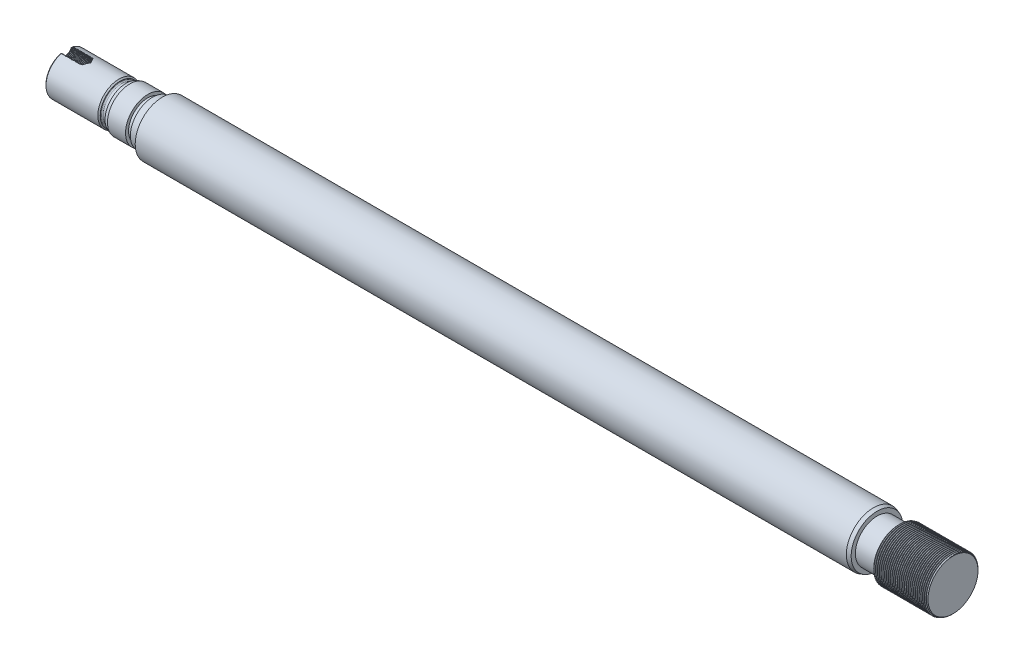
from build123d import *

# Parameters (mm, degrees)
M10_CLEARANCE_HOLE1_D     = 9
M10_CLEARANCE_HOLE1_DEPTH = 18
M10_CLEARANCE_HOLE1_TIP   = 2.7038727856240214
THREAD1_PITCH             = 1
THREAD2_PITCH             = 1.5000000000000002


with BuildPart() as part:
    # Sketch1 → Revolve1 (revolve)
    with BuildSketch(Plane(origin=(0, 0, 0), x_dir=(1, 0, 0), z_dir=(0, 1, 0)), mode=Mode.PRIVATE) as revolve1_sk:
        with BuildLine():
            Line((0, 0), (736, 0))
            Line((736, 0), (736, 20.749999999999996))
            Line((736, 20.749999999999996), (735, 21.75))
            Line((735, 21.75), (692, 21.75))
            Line((692, 21.75), (691, 20.749999999999996))
            Line((691, 20.749999999999996), (691, 18))
            Line((691, 18), (672.9999999999999, 18))
            Line((672.9999999999999, 18), (672.9999999999999, 21.5))
            Line((672.9999999999999, 21.5), (669.9999999999999, 22.5))
            Line((669.9999999999999, 22.5), (79.99999999999999, 22.5))
            Line((79.99999999999999, 22.5), (79.99999999999999, 18.5))
            Line((79.99999999999999, 18.5), (72, 18.5))
            Line((72, 18.5), (72, 16.000000000000004))
            Line((72, 16.000000000000004), (67.99999999999999, 16.000000000000004))
            Line((67.99999999999999, 16.000000000000004), (68, 18.500000000000004))
            Line((68, 18.500000000000004), (53.00000000000001, 18.500000000000004))
            Line((53.00000000000001, 18.500000000000004), (50, 17.5))
            Line((50, 17.5), (50, 16))
            ThreePointArc((50, 16), (49.707106781186546, 15.292893218813456), (49, 15.000000000000004))
            Line((49, 15.000000000000004), (46, 15.000000000000002))
            ThreePointArc((46, 15.000000000000002), (45.292893218813454, 15.292893218813452), (45, 16))
            Line((45, 16), (44.999999999999986, 16.5))
            Line((44.999999999999986, 16.5), (43.999999999999986, 17.5))
            Line((43.999999999999986, 17.5), (1, 17.5))
            Line((1, 17.5), (0, 16.5))
            Line((0, 16.5), (0, 0))
        make_face()
    revolve(revolve1_sk.sketch.rotate(Axis((0, 0, 0), (1, 0, 0)), 180), axis=Axis((0, 0, 0), (1, 0, 0)))

    # M10 Clearance Hole1
    with Locations(Plane.ZY):
        with Locations((0, 17.5)):
            Hole(M10_CLEARANCE_HOLE1_D / 2, depth=M10_CLEARANCE_HOLE1_DEPTH)
            with Locations((0, 0, -(M10_CLEARANCE_HOLE1_DEPTH + M10_CLEARANCE_HOLE1_TIP / 2))):  # 118° drill point
                Cone(0, M10_CLEARANCE_HOLE1_D / 2, M10_CLEARANCE_HOLE1_TIP, mode=Mode.SUBTRACT)

    # Thread1: arcs per turn and ends read off the stored shape
    # Thread1: the profile of Thread Profile1 profile screwed along a right-hand helix through 18 turns, 8 arcs to a turn; built about Z, then put on its axis
    thread1_z = Axis((0, 0, 0), (0, 0, 1))
    thread1_corners = [(4.4997, 0, -0.000173205), (4.4997, 0, 0.875173202), (5.041265875, 0, 0.562499999), (5.041265875, 0, 0.312499999)]
    with BuildLine(mode=Mode.PRIVATE) as thread1_profile:
        Line(thread1_corners[0], thread1_corners[1])
        Line(thread1_corners[1], thread1_corners[2])
        Line(thread1_corners[2], thread1_corners[3])
        Line(thread1_corners[3], thread1_corners[0])
    thread1_cap = Face(thread1_profile.wire())
    thread1_turn_angles = [0, 22.5, 45, 67.5, 90, 112.5, 135, 157.5, 180, 202.5, 225, 247.5, 270, 292.5, 315, 337.5, 360]
    thread1_turn_weights = [1, 0.9238795325112867, 1, 0.9238795325112867, 1, 0.9238795325112867, 1, 0.9238795325112867, 1, 0.9238795325112867, 1, 0.9238795325112867, 1, 0.9238795325112867, 1, 0.9238795325112867, 1]
    thread1_turn_rails = [Edge.make_bspline([Vector(p[0], p[1], 0).rotate(thread1_z, thread1_turn_angles[k]) / thread1_turn_weights[k] + Vector(0, 0, p[2] + THREAD1_PITCH * thread1_turn_angles[k] / 360) for k in range(17)], [0, 0, 0, 1, 1, 2, 2, 3, 3, 4, 4, 5, 5, 6, 6, 7, 7, 8, 8, 8], 2, thread1_turn_weights) for p in thread1_corners]
    thread1_turn_sides = [Face.make_surface_from_curves(thread1_turn_rails[p[0]], thread1_turn_rails[p[1]]) for p in [(0, 1), (1, 2), (2, 3), (3, 0)]]
    thread1 = Plane(origin=(-1, 17.5, 0), x_dir=(0, 0, -1), z_dir=(1, 0, 0)) * Solid(Shell([*[p.moved(Location((0, 0, THREAD1_PITCH * i))) for i in range(18) for p in thread1_turn_sides], thread1_cap, thread1_cap.rotate(thread1_z, 6480).moved(Location((0, 0, THREAD1_PITCH * 6480 / 360)))]))
    add(thread1, mode=Mode.SUBTRACT)

    # Thread2: arcs per turn and ends read off the stored shape
    # Thread2: the profile of Thread Profile2 profile screwed along a right-hand helix through 30.666667 turns, 8 arcs to a turn; built about Z, then put on its axis
    thread2_z = Axis((0, 0, 0), (0, 0, 1))
    thread2_corners = [(21.7503, 0, -0.000173205), (21.7503, 0, 1.312673201), (20.938101187, 0, 0.843749998), (20.938101187, 0, 0.468749998)]
    with BuildLine(mode=Mode.PRIVATE) as thread2_profile:
        Line(thread2_corners[0], thread2_corners[1])
        Line(thread2_corners[1], thread2_corners[2])
        Line(thread2_corners[2], thread2_corners[3])
        Line(thread2_corners[3], thread2_corners[0])
    thread2_cap = Face(thread2_profile.wire())
    thread2_turn_angles = [0, 22.5, 45, 67.5, 90, 112.5, 135, 157.5, 180, 202.5, 225, 247.5, 270, 292.5, 315, 337.5, 360]
    thread2_turn_weights = [1, 0.9238795325112867, 1, 0.9238795325112867, 1, 0.9238795325112867, 1, 0.9238795325112867, 1, 0.9238795325112867, 1, 0.9238795325112867, 1, 0.9238795325112867, 1, 0.9238795325112867, 1]
    thread2_turn_rails = [Edge.make_bspline([Vector(p[0], p[1], 0).rotate(thread2_z, thread2_turn_angles[k]) / thread2_turn_weights[k] + Vector(0, 0, p[2] + THREAD2_PITCH * thread2_turn_angles[k] / 360) for k in range(17)], [0, 0, 0, 1, 1, 2, 2, 3, 3, 4, 4, 5, 5, 6, 6, 7, 7, 8, 8, 8], 2, thread2_turn_weights) for p in thread2_corners]
    thread2_turn_sides = [Face.make_surface_from_curves(thread2_turn_rails[p[0]], thread2_turn_rails[p[1]]) for p in [(0, 1), (1, 2), (2, 3), (3, 0)]]
    thread2_last_angles = [10800, 10822.5, 10845, 10867.5, 10890, 10912.5, 10935, 10957.5, 10980, 11002.5, 11025, 11032.5, 11040]
    thread2_last_weights = [1, 0.9238795325112867, 1, 0.9238795325112867, 1, 0.9238795325112867, 1, 0.9238795325112867, 1, 0.9238795325112867, 1, 0.9914448613738104, 1]
    thread2_last_rails = [Edge.make_bspline([Vector(p[0], p[1], 0).rotate(thread2_z, thread2_last_angles[k]) / thread2_last_weights[k] + Vector(0, 0, p[2] + THREAD2_PITCH * thread2_last_angles[k] / 360) for k in range(13)], [0, 0, 0, 1, 1, 2, 2, 3, 3, 4, 4, 5, 5, 6, 6, 6], 2, thread2_last_weights) for p in thread2_corners]
    thread2_last_sides = [Face.make_surface_from_curves(thread2_last_rails[p[0]], thread2_last_rails[p[1]]) for p in [(0, 1), (1, 2), (2, 3), (3, 0)]]
    thread2 = Plane(origin=(737, 0, 0), x_dir=(0, 0, 1), z_dir=(-1, 0, 0)) * Solid(Shell([*[p.moved(Location((0, 0, THREAD2_PITCH * i))) for i in range(30) for p in thread2_turn_sides], *thread2_last_sides, thread2_cap, thread2_cap.rotate(thread2_z, 11040).moved(Location((0, 0, THREAD2_PITCH * 11040 / 360)))]))
    add(thread2, mode=Mode.SUBTRACT)


solid = part.part
